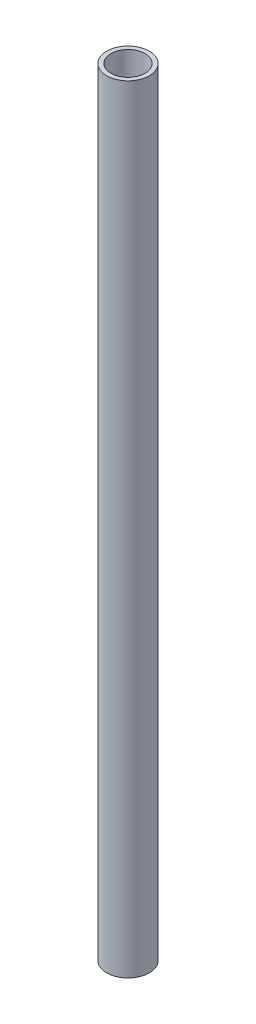
from build123d import *

# Parameters (mm, degrees)
SKETCH1_R           = 15.875
SKETCH1_R_2         = 12.7
BOSS_EXTRUDE1_DEPTH = 288.925


with BuildPart() as part:
    # Sketch1 → Boss-Extrude1 (new, symmetric)
    with BuildSketch(Plane(origin=(0, 0, 0), x_dir=(1, 0, 0), z_dir=(0, 1, 0))):
        Circle(SKETCH1_R)
        Circle(SKETCH1_R_2, mode=Mode.SUBTRACT)
    extrude(amount=BOSS_EXTRUDE1_DEPTH, both=True)


solid = part.part
